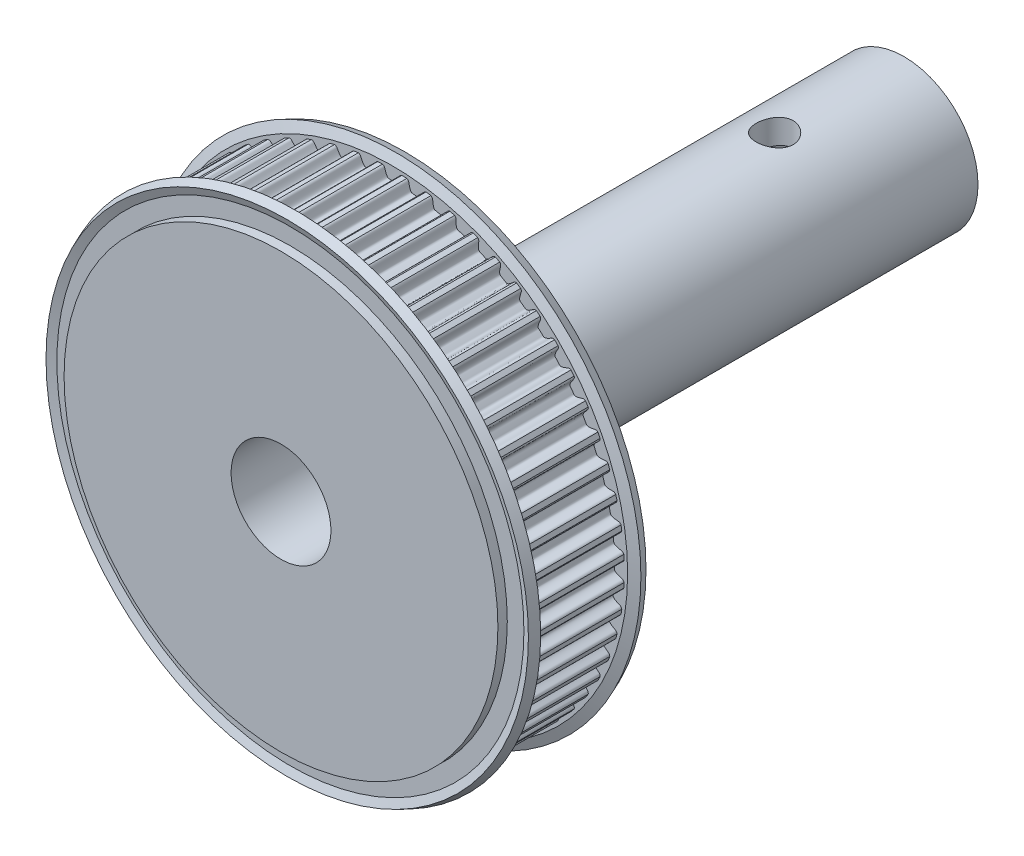
from build123d import *

# Parameters (mm, degrees)
TOOTHEXTRUDECUTGEARBELT01_DEPTH = 3.749999944
TOOTH_PATTERN_60_COUNT          = 60
BOREREVOLVESKETCH_W             = 10.547999842
BOREREVOLVESKETCH_H             = 5
SKETCH_5_R                      = 5
EXTRUDE_1_DEPTH                 = 11
SKETCH_7_R                      = 6
EXTRUDE_2_DEPTH                 = 40
SKETCH_8_R                      = 4.05
CUT_EXTRUDE_2_DEPTH             = 40
SKETCH_9_R                      = 4.05
CUT_EXTRUDE_3_DEPTH             = 40
CUT_EXTRUDE_4_DEPTH             = 54.278714017
CUT_EXTRUDE_4_DEPTH_BACK        = 54.278714017


with BuildPart() as part:
    # SketchRevolveGearBelt01 → Gates_PowerGrip_GT_2mm, 6mm Belt Width (revolve)
    with BuildSketch(Plane(origin=(0, 0, 0), x_dir=(0, 0, -1), z_dir=(1, 0, 0))):
        Polygon((5.273999921, 0), (5.273999921, 17.598592907), (4.511999932, 17.598592907), (4.511999932, 18.947021663), (4.769626867, 19.568988102), (4.065630673, 19.860592873), (3.749999944, 19.098592884), (3.749999944, 18.829777068), (-3.749999944, 18.829777068), (-3.749999944, 19.098592884), (-4.065630673, 19.860592873), (-4.769626867, 19.568988102), (-4.511999932, 18.947021663), (-4.511999932, 17.598592907), (-5.273999921, 17.598592907), (-5.273999921, 0), align=None)
    revolve(axis=Axis((0, 0, 0), (0, 0, -1)))

    # SketchToothGearBelt01 → ToothExtrudeCutGearBelt01 (cut, symmetric)
    with BuildSketch(Plane.XY):
        with BuildLine():
            ThreePointArc((18.824561725, 0.8607569), (18.844230591, 0), (18.824561725, -0.8607569))
            add(Edge.make_bspline(
                [(18.824561725, -0.8607569), (18.824358755, -0.843647502), (18.821568238, -0.818014662), (18.813004371, -0.784841875), (18.80422062, -0.760694594), (18.79315697, -0.737503183), (18.779915938, -0.715482229), (18.764619985, -0.694835789), (18.747410971, -0.675754118), (18.72844716, -0.658416999), (18.70790789, -0.642973095), (18.685969056, -0.629609433), (18.662886778, -0.618285204), (18.620626894, -0.603332735), (18.567324654, -0.587252719), (18.504797108, -0.567481602), (18.45234798, -0.549825565), (18.403068335, -0.532186929), (18.356964182, -0.51454656), (18.314032963, -0.496909291), (18.274273916, -0.479273963), (18.237685437, -0.461640694), (18.204265617, -0.444008949), (18.174011962, -0.426377751), (18.146921446, -0.408745201), (18.122990241, -0.391107907), (18.102215048, -0.373460068), (18.084590975, -0.355792311), (18.070124482, -0.33809054), (18.058803716, -0.320336691), (18.050717843, -0.302512788), (18.04567708, -0.28461649), (18.043475836, -0.250312541), (18.046658102, -0.199994192), (18.046802157, -0.1333067), (18.04757069, -0.066656855), (18.047684762, 0), (18.04757069, 0.066656855), (18.046802157, 0.1333067), (18.046658102, 0.199994192), (18.043475836, 0.250312541), (18.04567708, 0.28461649), (18.050717843, 0.302512788), (18.058803716, 0.320336691), (18.070124482, 0.33809054), (18.084590975, 0.355792311), (18.102215048, 0.373460068), (18.122990241, 0.391107907), (18.146921446, 0.408745201), (18.174011962, 0.426377751), (18.204265617, 0.444008949), (18.237685437, 0.461640694), (18.274273916, 0.479273963), (18.314032963, 0.496909291), (18.356964182, 0.51454656), (18.403068335, 0.532186929), (18.45234798, 0.549825565), (18.504797108, 0.567481602), (18.567324654, 0.587252719), (18.620626894, 0.603332735), (18.662886778, 0.618285204), (18.685969056, 0.629609433), (18.70790789, 0.642973095), (18.72844716, 0.658416999), (18.747410971, 0.675754118), (18.764619985, 0.694835789), (18.779915938, 0.715482229), (18.79315697, 0.737503183), (18.80422062, 0.760694594), (18.813004371, 0.784841875), (18.821568238, 0.818014662), (18.824358755, 0.843647502), (18.824561725, 0.8607569)],
                knots=[0, 0, 0, 0, 0.019512813, 0.029269219, 0.039025625, 0.048782032, 0.058538438, 0.068294844, 0.078051251, 0.087807657, 0.097564063, 0.10732047, 0.117076876, 0.126833283, 0.158411348, 0.180601822, 0.201643681, 0.221544022, 0.240311236, 0.257955332, 0.274488358, 0.289924961, 0.304283149, 0.317585307, 0.329859599, 0.341141892, 0.351478382, 0.360929145, 0.369572747, 0.377511751, 0.384878211, 0.391836853, 0.398582347, 0.423955538, 0.449303692, 0.474651846, 0.5, 0.525348154, 0.550696308, 0.576044462, 0.601417653, 0.608163147, 0.615121789, 0.622488249, 0.630427253, 0.639070855, 0.648521618, 0.658858108, 0.670140401, 0.682414693, 0.695716851, 0.710075039, 0.725511642, 0.742044668, 0.759688764, 0.778455978, 0.798356319, 0.819398178, 0.841588652, 0.873166717, 0.882923124, 0.89267953, 0.902435937, 0.912192343, 0.921948749, 0.931705156, 0.941461562, 0.951217968, 0.960974375, 0.970730781, 0.980487187, 1, 1, 1, 1], degree=3))
        make_face()
    toothextrudecutgearbelt01 = extrude(amount=TOOTHEXTRUDECUTGEARBELT01_DEPTH, both=True, mode=Mode.SUBTRACT)

    # Tooth Pattern, 60: ToothExtrudeCutGearBelt01 ×60 about axis
    tooth_pattern_60_axis = Axis((0, 0, 55), (0, 0, -1))
    for i in range(1, TOOTH_PATTERN_60_COUNT):
        add(toothextrudecutgearbelt01.rotate(tooth_pattern_60_axis, i * 360 / TOOTH_PATTERN_60_COUNT), mode=Mode.SUBTRACT)

    # BoreRevolveSketch → BoreRevolveCut (revolve, cut)
    with BuildSketch(Plane(origin=(0, 0, 0), x_dir=(0, 0, -1), z_dir=(1, 0, 0))):
        with Locations((0, 2.5)):
            Rectangle(BOREREVOLVESKETCH_W, BOREREVOLVESKETCH_H)
    revolve(axis=Axis((0, 0, 0), (0, 0, -1)), mode=Mode.SUBTRACT)

    # 草图5 → 凸台-拉伸1 (add)
    with BuildSketch(Plane.XY.offset(5.273999921)):
        Circle(SKETCH_5_R)
    extrude(amount=-EXTRUDE_1_DEPTH)

    # 草图7 → 凸台-拉伸2 (add)
    with BuildSketch(Plane(origin=(0, 0, -5.273999921), x_dir=(-1, 0, 0), z_dir=(0, 0, -1))):
        Circle(SKETCH_7_R)
    extrude(amount=EXTRUDE_2_DEPTH)

    # 草图8 → 切除-拉伸2 (cut)
    with BuildSketch(Plane(origin=(0, 0, -45.273999921), x_dir=(-1, 0, 0), z_dir=(0, 0, -1))):
        Circle(SKETCH_8_R)
    extrude(amount=-CUT_EXTRUDE_2_DEPTH, mode=Mode.SUBTRACT)

    # 草图9 → 切除-拉伸3 (cut)
    with BuildSketch(Plane(origin=(0, 0, -5.273999921), x_dir=(-1, 0, 0), z_dir=(0, 0, -1))):
        Circle(SKETCH_9_R)
    extrude(amount=-CUT_EXTRUDE_3_DEPTH, mode=Mode.SUBTRACT)

    # 草图10 → 切除-拉伸4 (cut, two sides: drawn at the far end of the back side and taken through both)
    with BuildSketch(Plane(origin=(0, 0, 0), x_dir=(1, 0, 0), z_dir=(0, 1, 0)).offset(-CUT_EXTRUDE_4_DEPTH_BACK)):
        with BuildLine():
            ThreePointArc((0, 36.273999921), (-1.060660172, 33.713339749), (1.5, 34.773999921))
            ThreePointArc((1.5, 34.773999921), (1.060660172, 35.834660093), (0, 36.273999921))
        make_face()
    extrude(amount=CUT_EXTRUDE_4_DEPTH + CUT_EXTRUDE_4_DEPTH_BACK, mode=Mode.SUBTRACT)


solid = part.part
